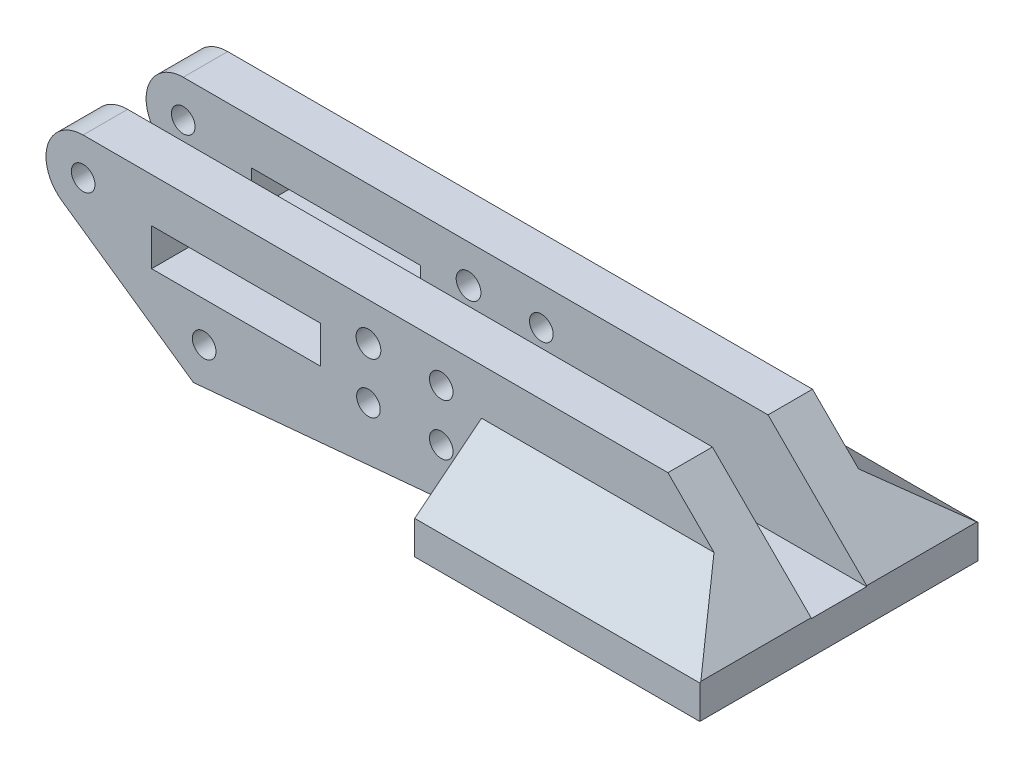
from build123d import *

# Parameters (mm, degrees)
RESSALTO_EXTRUS_O1_DEPTH         = 8
RESSALTO_EXTRUS_O2_DEPTH         = 51.268117765
CORTE_EXTRUS_O1_DEPTH            = 8.000000002
ESBO_O4_W                        = 51.268117776
ESBO_O4_H                        = 10.000000011
CORTE_EXTRUS_O2_DEPTH            = 17.723100001
CORTE_EXTRUS_O3_DEPTH            = 40.852574409
ESBO_O6_W                        = 51.268117776
ESBO_O6_H                        = 10.000000011
CORTE_EXTRUS_O4_DEPTH            = 0.151992449
RESSALTO_EXTRUS_O3_START         = 7.999999998
RESSALTO_EXTRUS_O3_DEPTH         = 7.999999998
RESSALTO_EXTRUS_O4_DEPTH         = 12.017232655
RESSALTO_EXTRUS_O5_DEPTH         = 12.017232657
ESBO_O10_W                       = 30.391419991
ESBO_O10_H                       = 6.689959998
CORTE_EXTRUS_O5_DEPTH            = 135.855194678
ESBO_O11_W                       = 30.391419991
ESBO_O11_H                       = 6.689959998
CORTE_EXTRUS_O6_DEPTH            = 135.855194677
ESBO_O12_W                       = 45.768117767
ESBO_O12_H                       = 44.53446532
CORTE_EXTRUS_O7_DEPTH            = 3.15
INCLINA_O1_START                 = 9.762479363
INCLINA_O1_DEPTH                 = 8.237520637
INCLINA_O2_START                 = -6.465378083
INCLINA_O2_DEPTH                 = 8.465378083
INCLINA_O3_ANGLE                 = 84.752120974
FURO_COM_FOLGA_DE_M41_D          = 4.452840696
FURO_COM_FOLGA_DE_M41_DEPTH      = 7.999999998
FURO_DE_DI_METRO_4_2_4_2_1_D     = 4.2
FURO_DE_DI_METRO_4_2_4_2_1_DEPTH = 7.999999998
FURO_COM_FOLGA_DE_M42_D          = 4.452840696
FURO_COM_FOLGA_DE_M42_DEPTH      = 38.017232657
FURO1_D                          = 4.246430182
FURO1_DEPTH                      = 38.017232657


with BuildPart() as part:
    # Esboço1 → Ressalto-extrusão1 (new body)
    with BuildSketch(Plane.XY.offset(8)):
        with BuildLine():
            Line((-36.110267765, -64.727666859), (-36.110267765, 0))
            Line((-36.110267765, 0), (-107.75607805, 0))
            ThreePointArc((-107.75607805, 0), (-114.12766225, -4.677735132), (-111.573397577, -12.157977319))
            Line((-111.573397577, -12.157977319), (-36.110267765, -64.727666859))
        make_face()
    extrude(amount=-RESSALTO_EXTRUS_O1_DEPTH)

    # Esboço2 → Ressalto-extrusão2 (add)
    with BuildSketch(Plane(origin=(-36.110267765, 0, 0), x_dir=(0, 0, -1), z_dir=(1, 0, 0))):
        with BuildLine():
            Line((2e-09, 1e-09), (2e-09, -23.87509245))
            add(Edge.make_bspline(
                [(2e-09, -64.727666859), (2e-09, -51.110142056), (2e-09, -37.492617253), (2e-09, -23.87509245)],
                knots=[0, 0, 0, 0, 1, 1, 1, 1], degree=3))
            Line((2e-09, -64.727666859), (-18.000000002, -64.727666859))
            add(Edge.make_bspline(
                [(-18.000000002, -64.727666859), (-18.000000002, -51.110142056), (-18.000000002, -37.492617253), (-18.000000002, -23.87509245)],
                knots=[0, 0, 0, 0, 1, 1, 1, 1], degree=3))
            Line((-18.000000002, -23.87509245), (-18.000000002, -17.875092449))
            add(Edge.make_bspline(
                [(-18.000000002, -17.723099999), (-18.000000002, -17.773764149), (-18.000000002, -17.824428299), (-18.000000002, -17.875092449)],
                knots=[0, 0, 0, 0, 1, 1, 1, 1], degree=3))
            add(Edge.make_bspline(
                [(-18.000000002, 1e-09), (-18.000000002, -5.907699999), (-18.000000002, -11.815399999), (-18.000000002, -17.723099999)],
                knots=[0, 0, 0, 0, 1, 1, 1, 1], degree=3))
            Line((-18.000000002, 1e-09), (2e-09, 1e-09))
        make_face()
    extrude(amount=RESSALTO_EXTRUS_O2_DEPTH)

    # Esboço3 → Corte-extrusão1 (cut)
    with BuildSketch(Plane(origin=(0, 0, 0), x_dir=(-1, 0, 0), z_dir=(0, 0, -1))):
        Polygon((-15.15785, 0), (-15.15785, -17.7231), (2.585682, 0), align=None)
    extrude(amount=-CORTE_EXTRUS_O1_DEPTH, mode=Mode.SUBTRACT)

    # Esboço4 → Corte-extrusão2 (cut)
    with BuildSketch(Plane(origin=(0, 0, 0), x_dir=(-1, 0, 0), z_dir=(0, 1, 0))):
        with Locations((10.476208888, 13.000000002)):
            Rectangle(ESBO_O4_W, ESBO_O4_H)
    extrude(amount=-CORTE_EXTRUS_O2_DEPTH, mode=Mode.SUBTRACT)

    # Esboço5 → Corte-extrusão3 (cut)
    with BuildSketch(Plane.XZ.offset(64.727666859)):
        Polygon((15.15785, 18.000000002), (-36.110267765, 18.000000002), (-36.110267765, 8), (-36.110267765, -2e-09), (15.15785, -2e-09), align=None)
    extrude(amount=-CORTE_EXTRUS_O3_DEPTH, mode=Mode.SUBTRACT)

    # Esboço6 → Corte-extrusão4 (cut)
    with BuildSketch(Plane(origin=(0, -17.723100001, 0), x_dir=(-1, 0, 0), z_dir=(0, 1, 0))):
        with Locations((10.476208888, 13.000000002)):
            Rectangle(ESBO_O6_W, ESBO_O6_H)
    extrude(amount=-CORTE_EXTRUS_O4_DEPTH, mode=Mode.SUBTRACT)

    # Esboço7 → Ressalto-extrusão3 (add)
    with BuildSketch(Plane.XY.offset(18.000000002).offset(RESSALTO_EXTRUS_O3_START)):
        with BuildLine():
            Line((-36.110267767, -23.87509245), (-36.110267767, -64.727666793))
            Line((-36.110267767, -64.727666793), (-111.573397573, -12.157977315))
            ThreePointArc((-111.573397573, -12.157977315), (-114.127662248, -4.677735132), (-107.75607805, 1e-09))
            Line((-107.75607805, 1e-09), (-2.585681995, 1e-09))
            Line((-2.585681995, 1e-09), (5.698950337, -8.275092449))
            Line((5.698950337, -8.275092449), (15.157849978, -17.723100021))
            Line((15.157849978, -17.723100021), (15.157849978, -23.87509245))
            Line((15.157849978, -23.87509245), (-36.110267767, -23.87509245))
        make_face()
    extrude(amount=-RESSALTO_EXTRUS_O3_DEPTH)

    # Esboço8 → Ressalto-extrusão4 (add)
    with BuildSketch(Plane(origin=(0, 0, 0), x_dir=(-1, 0, 0), z_dir=(0, 0, -1))):
        Polygon((36.110267765, -8.275092449), (36.110267765, -23.87509245), (-15.15785, -23.87509245), (-15.15785, -17.7231), (-5.698950354, -8.275092449), align=None)
    extrude(amount=RESSALTO_EXTRUS_O4_DEPTH)

    # Esboço9 → Ressalto-extrusão5 (add)
    with BuildSketch(Plane.XY.offset(26)):
        Polygon((15.15785, -17.7231), (15.15785, -23.87509245), (-36.110267765, -23.87509245), (-36.110267765, -8.275092449), (5.698950354, -8.275092449), align=None)
    extrude(amount=RESSALTO_EXTRUS_O5_DEPTH)

    # Esboço10 → Corte-extrusão5 (cut, through all)
    with BuildSketch(Plane.XY.offset(8)):
        with Locations((-80.248070001, -11.317270001)):
            Rectangle(ESBO_O10_W, ESBO_O10_H)
    extrude(amount=-CORTE_EXTRUS_O5_DEPTH, mode=Mode.SUBTRACT)

    # Esboço11 → Corte-extrusão6 (cut, through all)
    with BuildSketch(Plane(origin=(0, 0, 18.000000002), x_dir=(-1, 0, 0), z_dir=(0, 0, -1))):
        with Locations((80.248070001, -11.317270001)):
            Rectangle(ESBO_O11_W, ESBO_O11_H)
    extrude(amount=-CORTE_EXTRUS_O6_DEPTH, mode=Mode.SUBTRACT)

    # Esboço12 → Corte-extrusão7 (cut)
    with BuildSketch(Plane.XZ.offset(23.87509245)):
        with Locations((-10.476208882, 13)):
            Rectangle(ESBO_O12_W, ESBO_O12_H)
    extrude(amount=-CORTE_EXTRUS_O7_DEPTH, mode=Mode.SUBTRACT)

    # Inclinação1: read off the stored shape, not the designer's step
    # Inclinação1 outline → Inclinação1 (cut)
    with BuildSketch(Plane(origin=(0, 0, 0), x_dir=(1, 0, 0), z_dir=(0, 0.7813058431702609, 0.624148363314371)).offset(INCLINA_O1_START)):
        Polygon((-36.110267765, -40.859795712), (15.15785, -40.859795712), (15.15785, -40.616276003), (5.698950337, -25.478837331), (-36.110267765, -25.478837331), align=None)
    extrude(amount=INCLINA_O1_DEPTH, mode=Mode.SUBTRACT)

    # Inclinação2: read off the stored shape, not the designer's step
    # Inclinação2 outline → Inclinação2 (cut)
    with BuildSketch(Plane(origin=(0, 0, 0), x_dir=(1, 0, 0), z_dir=(0, 0.7813058431702609, -0.624148363314371)).offset(INCLINA_O2_START)):
        Polygon((5.698950354, 5.164885408), (15.15785, 20.302324047), (15.15785, 20.545843787), (-36.110267765, 20.545843787), (-36.110267765, 5.164885408), align=None)
    extrude(amount=INCLINA_O2_DEPTH, mode=Mode.SUBTRACT)

    # Inclinação3
    inclina_o3_faces = [part.faces().sort_by_distance(p)[0] for p in [
        (-36.110267765, -44.301379654, 3.999999999),
        (-36.110267767, -44.301379621, 22.000000001),
    ]]
    draft(inclina_o3_faces, Plane(origin=(0, -23.87509245, 0), x_dir=(0, 0, -1), z_dir=(0, -1, 0)), INCLINA_O3_ANGLE)

    # Furo com folga de M41
    with Locations(Plane.XY.offset(26)):
        with Locations((-56.444514416, -6.798608997)):
            Hole(FURO_COM_FOLGA_DE_M41_D / 2, depth=FURO_COM_FOLGA_DE_M41_DEPTH)

    # Furo de diâmetro Ø4.2 (4.2)1
    with Locations(Plane.XY.offset(26)):
        with Locations((-85.990622049, -21.806552958), (-107.75607805, -6.678263028), (-43.350632153, -6.798608997), (-56.444514416, -16.052089875), (-43.350632153, -16.052089875)):
            Hole(FURO_DE_DI_METRO_4_2_4_2_1_D / 2, depth=FURO_DE_DI_METRO_4_2_4_2_1_DEPTH)

    # Furo com folga de M42
    with Locations(Plane(origin=(0, 0, 0), x_dir=(-1, 0, 0), z_dir=(0, 0, -1))):
        with Locations((56.444514416, -6.798608997)):
            Hole(FURO_COM_FOLGA_DE_M42_D / 2, depth=FURO_COM_FOLGA_DE_M42_DEPTH)

    # Furo1
    with Locations(Plane(origin=(0, 0, 0), x_dir=(-1, 0, 0), z_dir=(0, 0, -1))):
        with Locations((43.350632153, -16.052089875), (56.444514416, -16.052089875), (43.350632153, -6.798608997), (107.75607805, -6.678263028), (85.990622049, -21.806552958)):
            Hole(FURO1_D / 2, depth=FURO1_DEPTH)


solid = part.part
